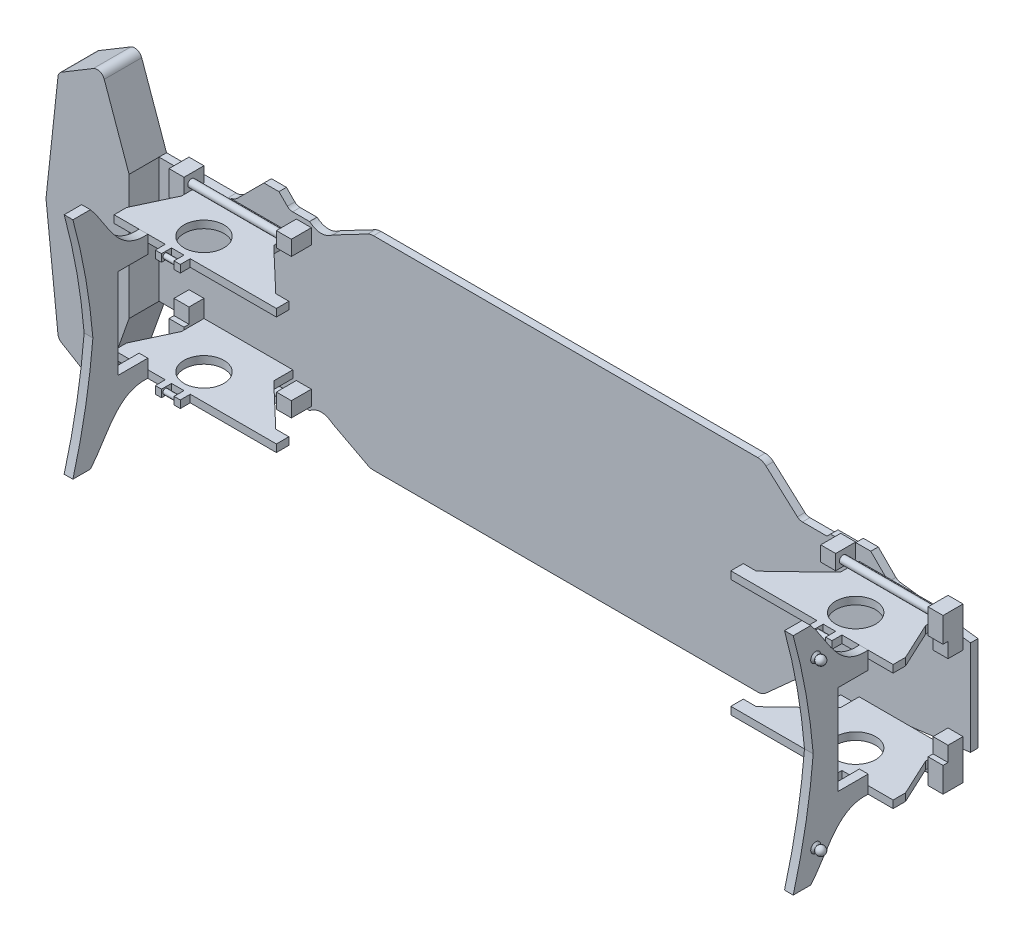
from build123d import *

# Parameters (mm, degrees)
EXTRUDE_1_DEPTH          = 3
SKETCH_2_W               = 6
SKETCH_2_H               = 4
SKETCH_2_H_2             = 6
EXTRUDE_2_DEPTH          = 8
SKETCH_3_W               = 6
SKETCH_3_H               = 8
EXTRUDE_3_DEPTH          = 6
SKETCH_6_W               = 6
SKETCH_6_H               = 6
EXTRUDE_4_DEPTH          = 6
MIRROR_START             = 3
MIRROR_2_OUTLINE_W       = 6
MIRROR_2_OUTLINE_H       = 6
MIRROR_2_DEPTH           = 6
MIRROR_START_2           = 9
MIRROR_2_2_OUTLINE_W     = 6
MIRROR_2_2_OUTLINE_H     = 6
MIRROR_2_2_DEPTH         = 2
SKETCH_7_W               = 6
SKETCH_7_H               = 8
EXTRUDE_5_DEPTH          = 10
SKETCH_9_R               = 8
EXTRUDE_8_DEPTH          = 3
EXTRUDE_10_DEPTH         = 3.5
EXTRUDE_11_DEPTH         = 15
MIRROR_4_COPY_1_SKETCH_R = 8
MIRROR_4_COPY_1_DEPTH    = 3
MIRROR_4_COPY_2_DEPTH    = 3.5
SKETCH_4_R               = 1.5
EXTRUDE_12_DEPTH         = 37
SKETCH_20_R              = 1.5
EXTRUDE_13_DEPTH         = 37
SKETCH_14_W              = 2.5
SKETCH_14_H              = 1.5
EXTRUDE_14_DEPTH         = 4
SKETCH_21_R              = 1
EXTRUDE_15_DEPTH         = 5
MIRROR_9_COPY_1_SKETCH_W = 2.5
MIRROR_9_COPY_1_SKETCH_H = 1.5
MIRROR_9_COPY_1_DEPTH    = 4
MIRROR_9_COPY_2_SKETCH_R = 1
MIRROR_9_COPY_2_DEPTH    = 5


# Read off the part's stored shape, not the designer's step: 镜向2
with BuildPart() as part:
    # 草图1 → 凸台-拉伸1 (new body)
    with BuildSketch(Plane.XY):
        with BuildLine():
            Line((0, 0), (27.928932188, 0))
            ThreePointArc((27.928932188, 0), (29.84234935, -0.380602337), (31.464466094, -1.464466094))
            Line((31.464466094, -1.464466094), (42.02081528, -12.02081528))
            Line((42.02081528, -12.02081528), (48.02081528, -12.02081528))
            Line((48.02081528, -12.02081528), (51.384776311, -8.656854249))
            ThreePointArc((51.384776311, -8.656854249), (52.358046357, -8.006535996), (53.506096654, -7.778174593))
            Line((53.506096654, -7.778174593), (60.263455967, -7.778174593))
            add(Edge.make_bspline(
                [(60.263455967, -7.778174593), (64.931095585, -4.193127646), (69.598735202, -7.778174593)],
                knots=[0, 0, 0, 1, 1, 1], degree=2))
            Line((69.598735202, -7.778174593), (83.56724933, -15.096547707))
            ThreePointArc((83.56724933, -15.096547707), (84.692841249, -15.522730831), (85.887665553, -15.667589754))
            Line((85.887665553, -15.667589754), (239.737872066, -15.667589754))
            ThreePointArc((239.737872066, -15.667589754), (241.529711814, -15.335491886), (243.083525098, -14.383313881))
            Line((243.083525098, -14.383313881), (255.664289037, -3.05554315))
            ThreePointArc((255.664289037, -3.05554315), (256.596577008, -2.484236347), (257.671680856, -2.284977627))
            Line((257.671680856, -2.284977627), (267.520088751, -2.284977627))
            Line((267.520088751, -2.284977627), (268.934302314, -3.699191189))
            Line((268.934302314, -3.699191189), (276.934302314, -3.699191189))
            Line((276.934302314, -3.699191189), (279.055622657, -5.820511533))
            Line((279.055622657, -5.820511533), (285.055622657, -5.820511533))
            Line((285.055622657, -5.820511533), (292.106738099, 1.23060391))
            ThreePointArc((292.106738099, 1.23060391), (292.90911491, 1.803794274), (293.853989755, 2.085870977))
            Line((293.853989755, 2.085870977), (325, 6))
            Line((325, 6), (325, 25))
            Line((325, 25), (0, 25))
            Line((0, 25), (0, 0))
        make_face()
    extrude_1 = extrude(amount=EXTRUDE_1_DEPTH)

    # 草图2 → 凸台-拉伸2 (add)
    with BuildSketch(Plane.XY.offset(3)):
        with Locations((15, 2)):
            Rectangle(SKETCH_2_W, SKETCH_2_H)
        with Locations((58, -3)):
            Rectangle(SKETCH_2_W, SKETCH_2_H_2)
    extrude_2 = extrude(amount=EXTRUDE_2_DEPTH)

    # 草图3 → 凸台-拉伸3 (add)
    with BuildSketch(Plane.XZ):
        with Locations((15, 7)):
            Rectangle(SKETCH_3_W, SKETCH_3_H)
    extrude_3 = extrude(amount=EXTRUDE_3_DEPTH)

    # 草图6 → 凸台-拉伸4 (add)
    with BuildSketch(Plane.XY.offset(3)):
        with Locations((15, 7)):
            Rectangle(SKETCH_6_W, SKETCH_6_H)
    extrude_4 = extrude(amount=EXTRUDE_4_DEPTH)

    # 镜向2 outline → 镜向2 (add)
    with BuildSketch(Plane.XY.offset(MIRROR_START)):
        with Locations((276, -3)):
            Rectangle(MIRROR_2_OUTLINE_W, MIRROR_2_OUTLINE_H)
        with Locations((319, 7)):
            Rectangle(MIRROR_2_OUTLINE_W, MIRROR_2_OUTLINE_H)
    mirror_2 = extrude(amount=MIRROR_2_DEPTH)

    # Mirror 2 2 outline → Mirror 2 2 (add)
    with BuildSketch(Plane.XY.offset(MIRROR_START_2)):
        with Locations((276, -3)):
            Rectangle(MIRROR_2_2_OUTLINE_W, MIRROR_2_2_OUTLINE_H)
    mirror_2_2 = extrude(amount=MIRROR_2_2_DEPTH)

    # 草图7 → 凸台-拉伸5 (add)
    with BuildSketch(Plane.XZ.offset(-4)):
        with Locations((319, 7)):
            Rectangle(SKETCH_7_W, SKETCH_7_H)
    extrude_5 = extrude(amount=EXTRUDE_5_DEPTH)

    # 草图9 → 凸台-拉伸8 (add)
    with BuildSketch(Plane(origin=(0, 0, 0), x_dir=(1, 0, 0), z_dir=(0, 1, 0))):
        Polygon((53.585786438, -3), (18, -3), (18, -12), (11, -27), (11, -32), (18, -32), (76, -32), (76, -27), (70.75, -27), (55, -12), (53.585786438, -10.585786438), align=None)
        with Locations(Location((36.5, -21.5, 0), (0, 0, 270))):
            Circle(SKETCH_9_R, mode=Mode.SUBTRACT)
    extrude_8 = extrude(amount=EXTRUDE_8_DEPTH)

    # 草图16 → 凸台-拉伸10 (add)
    with BuildSketch(Plane.ZY.offset(-21)):
        with BuildLine():
            add(Edge.make_bspline(
                [(54, 25), (55.922172516, 2.14235842), (62, -20)],
                knots=[0, 0, 0, 1, 1, 1], degree=2))
            Line((62, -20), (55, -20))
            add(Edge.make_bspline(
                [(32, 0), (44.752015456, 0.895802928), (48.259684144, -12.429989679), (55, -20)],
                knots=[0, 0, 0, 0, 1, 1, 1, 1], degree=3))
            Line((32, 0), (32, 7))
            Line((32, 7), (44, 7))
            Line((44, 7), (44, 25))
            Line((44, 25), (54, 25))
        make_face()
    extrude_10 = extrude(amount=-EXTRUDE_10_DEPTH)

    # 草图18 → 旋转6 (revolve)
    with BuildSketch(Plane.XY.offset(53), mode=Mode.PRIVATE) as revolve_6_sk:
        with BuildLine():
            Line((21, -8), (21, -6))
            Line((21, -6), (20.237436867, -6.762563133))
            ThreePointArc((20.237436867, -6.762563133), (18.330303993, -6.383210818), (17.25, -8))
            Line((17.25, -8), (19, -8))
            Line((19, -8), (21, -8))
        make_face()
    revolve_6 = revolve(revolve_6_sk.sketch.rotate(Axis((19, -8, 53), (-1, 0, 0)), 90), axis=Axis((19, -8, 53), (-1, 0, 0)))

    # 镜向3: 凸台-拉伸8, 凸台-拉伸10, 旋转6 across plane
    add(extrude_8.mirror(Plane.ZY.offset(-167)))
    add(extrude_10.mirror(Plane.ZY.offset(-167)))
    add(revolve_6.mirror(Plane.ZY.offset(-167)))

    # 草图19 → 凸台-拉伸11 (add)
    with BuildSketch(Plane(origin=(0, 0, 0), x_dir=(-1, 0, 0), z_dir=(0, 0, -1))):
        with BuildLine():
            Line((0, 25), (0, 0))
            Line((0, 0), (9.945600364, -27.991704422))
            ThreePointArc((9.945600364, -27.991704422), (11.759476991, -29.811104141), (14.316254404, -29.55960262))
            Line((14.316254404, -29.55960262), (27.041707014, -21.922316259))
            ThreePointArc((27.041707014, -21.922316259), (28.02596013, -20.965261617), (28.480811429, -19.669955445))
            Line((28.480811429, -19.669955445), (33.272011513, 25))
            Line((33.272011513, 25), (0, 25))
        make_face()
    extrude_11 = extrude(amount=-EXTRUDE_11_DEPTH)

    # 镜向4: 凸台-拉伸1, 凸台-拉伸2, 凸台-拉伸3, 凸台-拉伸4, 镜向2, Mirror 2 2, 凸台-拉伸5, 凸台-拉伸8, 凸台-拉伸10, 旋转6, 凸台-拉伸11 across plane
    add(extrude_1.mirror(Plane(origin=(0, 25, 3), x_dir=(0, 0, 1), z_dir=(0, -1, 0))))
    add(extrude_2.mirror(Plane(origin=(0, 25, 3), x_dir=(0, 0, 1), z_dir=(0, -1, 0))))
    add(extrude_3.mirror(Plane(origin=(0, 25, 3), x_dir=(0, 0, 1), z_dir=(0, -1, 0))))
    add(extrude_4.mirror(Plane(origin=(0, 25, 3), x_dir=(0, 0, 1), z_dir=(0, -1, 0))))
    add(mirror_2.mirror(Plane(origin=(0, 25, 3), x_dir=(0, 0, 1), z_dir=(0, -1, 0))))
    add(mirror_2_2.mirror(Plane(origin=(0, 25, 3), x_dir=(0, 0, 1), z_dir=(0, -1, 0))))
    add(extrude_5.mirror(Plane(origin=(0, 25, 3), x_dir=(0, 0, 1), z_dir=(0, -1, 0))))
    add(extrude_8.mirror(Plane(origin=(0, 25, 3), x_dir=(0, 0, 1), z_dir=(0, -1, 0))))
    add(extrude_10.mirror(Plane(origin=(0, 25, 3), x_dir=(0, 0, 1), z_dir=(0, -1, 0))))
    add(revolve_6.mirror(Plane(origin=(0, 25, 3), x_dir=(0, 0, 1), z_dir=(0, -1, 0))))
    add(extrude_11.mirror(Plane(origin=(0, 25, 3), x_dir=(0, 0, 1), z_dir=(0, -1, 0))))

    # 镜向4 copy 1 sketch → 镜向4 copy 1 (add)
    with BuildSketch(Plane(origin=(334, 50, 0), x_dir=(-1, 0, 0), z_dir=(0, -1, 0))):
        Polygon((53.585786438, -3), (18, -3), (18, -12), (11, -27), (11, -32), (18, -32), (76, -32), (76, -27), (70.75, -27), (55, -12), (53.585786438, -10.585786438), align=None)
        with Locations(Location((36.5, -21.5, 0), (0, 0, 270))):
            Circle(MIRROR_4_COPY_1_SKETCH_R, mode=Mode.SUBTRACT)
    extrude(amount=MIRROR_4_COPY_1_DEPTH)

    # 镜向4 copy 2 sketch → 镜向4 copy 2 (add)
    with BuildSketch(Plane(origin=(313, 50, 0), x_dir=(0, 0, 1), z_dir=(1, 0, 0))):
        with BuildLine():
            add(Edge.make_bspline(
                [(54, 25), (55.922172516, 2.14235842), (62, -20)],
                knots=[0, 0, 0, 1, 1, 1], degree=2))
            Line((62, -20), (55, -20))
            add(Edge.make_bspline(
                [(32, 0), (44.752015456, 0.895802928), (48.259684144, -12.429989679), (55, -20)],
                knots=[0, 0, 0, 0, 1, 1, 1, 1], degree=3))
            Line((32, 0), (32, 7))
            Line((32, 7), (44, 7))
            Line((44, 7), (44, 25))
            Line((44, 25), (54, 25))
        make_face()
    extrude(amount=-MIRROR_4_COPY_2_DEPTH)

    # 镜向4 copy 3 sketch → 镜向4 copy 3 (revolve)
    with BuildSketch(Plane(origin=(334, 50, 53), x_dir=(-1, 0, 0), z_dir=(0, 0, 1))):
        with BuildLine():
            Line((21, -8), (21, -6))
            Line((21, -6), (20.237436867, -6.762563133))
            ThreePointArc((20.237436867, -6.762563133), (18.330303993, -6.383210818), (17.25, -8))
            Line((17.25, -8), (19, -8))
            Line((19, -8), (21, -8))
        make_face()
    revolve(axis=Axis((315, 58, 53), (1, 0, 0)))

    # 草图4 → 凸台-拉伸12 (add)
    with BuildSketch(Plane(origin=(18, 0, 0), x_dir=(0, 0, -1), z_dir=(1, 0, 0))):
        with Locations((-8, -2.5)):
            Circle(SKETCH_4_R)
    extrude_12 = extrude(amount=EXTRUDE_12_DEPTH)

    # 草图20 → 凸台-拉伸13 (add)
    with BuildSketch(Plane(origin=(18, 0, 0), x_dir=(0, 0, -1), z_dir=(1, 0, 0))):
        with Locations(Location((-8, 52.5, 0), (0, 0, 180))):
            Circle(SKETCH_20_R)
    extrude_13 = extrude(amount=EXTRUDE_13_DEPTH)

    # 镜向7: 凸台-拉伸12, 凸台-拉伸13 across plane
    add(extrude_12.mirror(Plane.ZY.offset(-167)))
    add(extrude_13.mirror(Plane.ZY.offset(-167)))

    # 草图14 → 凸台-拉伸14 (add)
    with BuildSketch(Plane.XY.offset(32)):
        with Locations((32.75, 2.25)):
            Rectangle(SKETCH_14_W, SKETCH_14_H)
        with Locations((32.75, 0.75)):
            Rectangle(SKETCH_14_W, SKETCH_14_H)
        Polygon((41.5, 3), (39, 3), (39, 1.5), (39, 0), (41.5, 0), align=None)
    extrude_14 = extrude(amount=EXTRUDE_14_DEPTH)

    # 草图21 → 凸台-拉伸15 (add)
    with BuildSketch(Plane(origin=(34, 0, 0), x_dir=(0, 0, -1), z_dir=(1, 0, 0))):
        with Locations((-34.5, 1.5)):
            Circle(SKETCH_21_R)
    extrude_15 = extrude(amount=EXTRUDE_15_DEPTH)

    # 镜向8: 凸台-拉伸14, 凸台-拉伸15 across plane
    add(extrude_14.mirror(Plane.ZY.offset(-167)))
    add(extrude_15.mirror(Plane.ZY.offset(-167)))

    # 镜向9: 凸台-拉伸14, 凸台-拉伸15 across plane
    add(extrude_14.mirror(Plane(origin=(0, 25, 0), x_dir=(0, 0, 1), z_dir=(0, -1, 0))))
    add(extrude_15.mirror(Plane(origin=(0, 25, 0), x_dir=(0, 0, 1), z_dir=(0, -1, 0))))

    # 镜向9 copy 1 sketch → 镜向9 copy 1 (add)
    with BuildSketch(Plane(origin=(334, 50, 32), x_dir=(-1, 0, 0), z_dir=(0, 0, 1))):
        with Locations((32.75, 2.25)):
            Rectangle(MIRROR_9_COPY_1_SKETCH_W, MIRROR_9_COPY_1_SKETCH_H)
        with Locations((32.75, 0.75)):
            Rectangle(MIRROR_9_COPY_1_SKETCH_W, MIRROR_9_COPY_1_SKETCH_H)
        Polygon((41.5, 3), (39, 3), (39, 1.5), (39, 0), (41.5, 0), align=None)
    extrude(amount=MIRROR_9_COPY_1_DEPTH)

    # 镜向9 copy 2 sketch → 镜向9 copy 2 (add)
    with BuildSketch(Plane(origin=(300, 50, 0), x_dir=(0, 0, -1), z_dir=(-1, 0, 0))):
        with Locations((-34.5, 1.5)):
            Circle(MIRROR_9_COPY_2_SKETCH_R)
    extrude(amount=MIRROR_9_COPY_2_DEPTH)


solid = part.part
